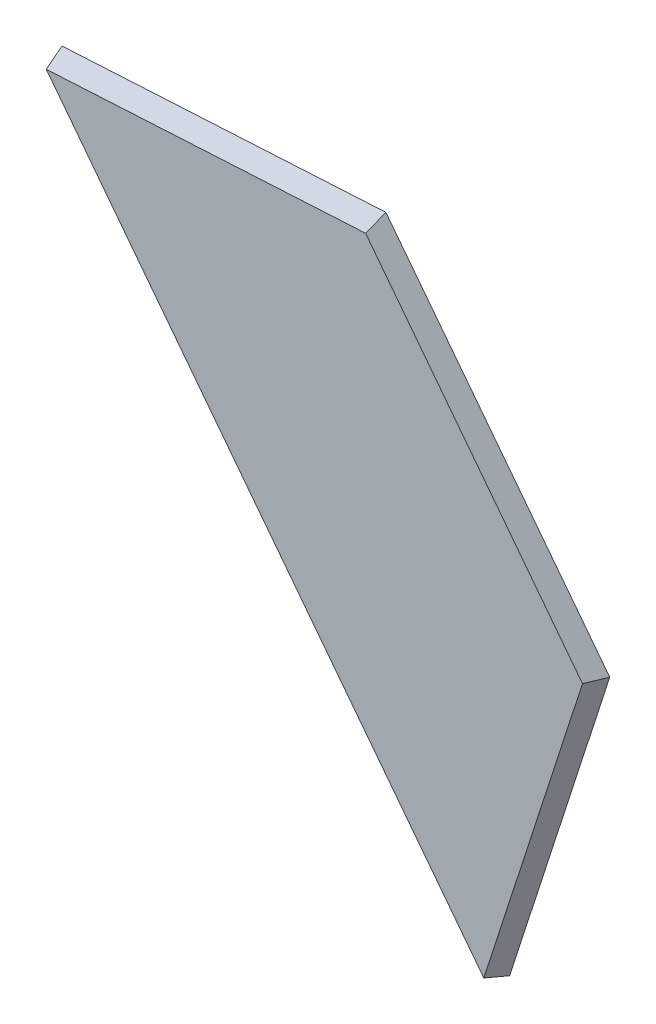
from build123d import *

# Parameters (mm, degrees)
EXTRUDE_1_DEPTH    = 60
CHAMFER3_SIZE2     = 11.912970931
CHAMFER3_SIZE      = 60
CHAMFER4_SIZE2     = 11.912970931
CHAMFER4_SIZE      = 60
CHAMFER5_SIZE2     = 9.519169095
CHAMFER5_SIZE      = 60
CUT_EXTRUDE1_DEPTH = 1279.275631979


with BuildPart() as part:
    # Эскиз1 → Бобышка-Вытянуть1 (new body)
    with BuildSketch(Plane.XY):
        Polygon((-849.589927609, 515.838957491), (787.506047005, 606.405063543), (281.615569427, -953.197537878), align=None)
    extrude(amount=EXTRUDE_1_DEPTH)

    # Chamfer3
    chamfer3_edges = [part.edges().sort_by_distance(p)[0] for p in [
        (-31.041940302, 561.122010517, 60),
    ]]
    chamfer3_side = [part.faces().sort_by_distance(p)[0] for p in [
        (-31.041940302, 561.122010517, 59.761740581),
    ]]
    chamfer(chamfer3_edges, length=CHAMFER3_SIZE - 0.0001, length2=CHAMFER3_SIZE2 - 0.0001, reference=chamfer3_side[0])  # a hair under: the kernel refuses the full size

    # Chamfer4
    chamfer4_edges = [part.edges().sort_by_distance(p)[0] for p in [
        (532.590398399, -179.470785737, 60),
    ]]
    chamfer4_side = [part.faces().sort_by_distance(p)[0] for p in [
        (532.590398399, -179.470785737, 59.761740581),
    ]]
    chamfer(chamfer4_edges, length=CHAMFER4_SIZE - 0.0001, length2=CHAMFER4_SIZE2 - 0.0001, reference=chamfer4_side[0])  # a hair under: the kernel refuses the full size

    # Chamfer5
    chamfer5_edges = [part.edges().sort_by_distance(p)[0] for p in [
        (-283.987179091, -218.679290193, 60),
    ]]
    chamfer5_side = [part.faces().sort_by_distance(p)[0] for p in [
        (-283.987179091, -218.679290193, 59.809616618),
    ]]
    chamfer(chamfer5_edges, length=CHAMFER5_SIZE - 0.0001, length2=CHAMFER5_SIZE2 - 0.0001, reference=chamfer5_side[0])  # a hair under: the kernel refuses the full size

    # Sketch1 → Cut-Extrude1 (cut, through all)
    with BuildSketch(Plane(origin=(0, 0, 0), x_dir=(-1, 0, 0), z_dir=(0, 0, -1))):
        Polygon((-534.560808216, -173.396237168), (31.041940302, 561.122010517), (-787.506047005, 606.405063543), align=None)
    extrude(amount=-CUT_EXTRUDE1_DEPTH, mode=Mode.SUBTRACT)


solid = part.part
